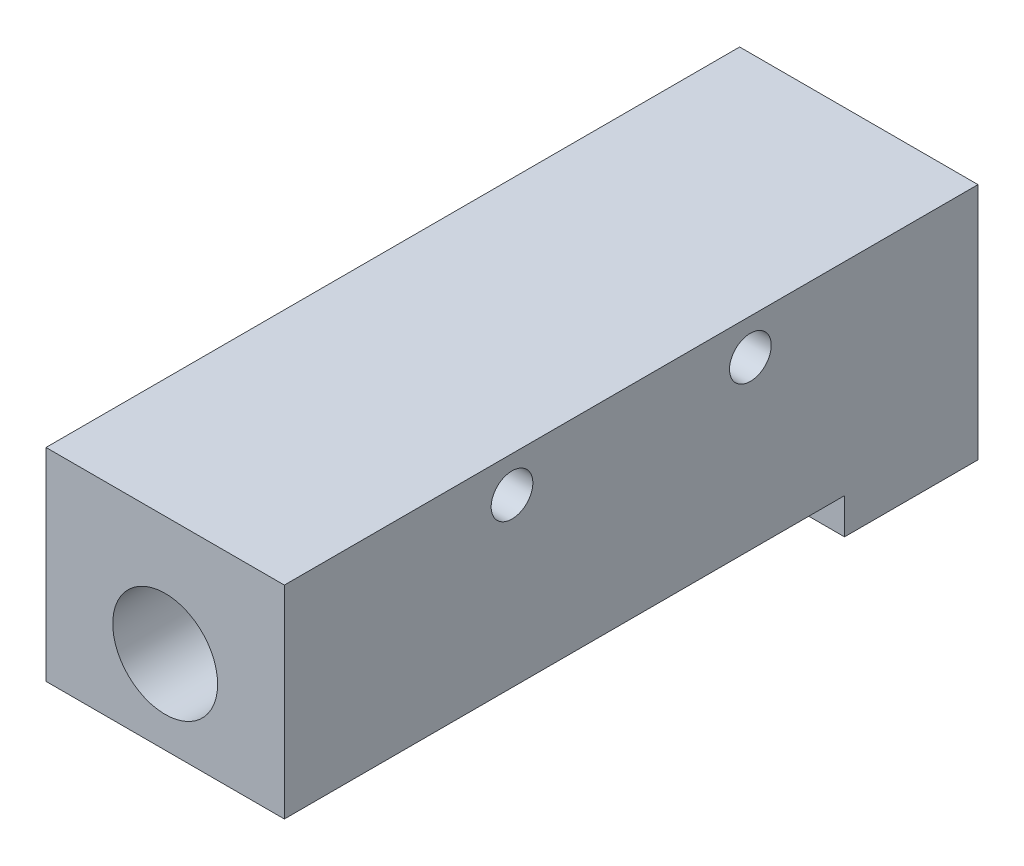
from build123d import *

# Parameters (mm, degrees)
SCHIZZO1_W                    = 20
SCHIZZO1_H                    = 20
ESTRUSIONE_ESTRUSIONE1_DEPTH  = 58.2
SCHIZZO2_R                    = 3
TAGLIO_ESTRUSIONE1_DEPTH      = 60.893572276
SCHIZZO3_R                    = 6
TAGLIO_ESTRUSIONE2_DEPTH      = 13
SCHIZZO4_R                    = 1.75
TAGLIO_ESTRUSIONE3_DEPTH      = 63.347734522
FORO_FILETTATO_G1_8_1_D       = 8.8
FORO_FILETTATO_G1_8_1_DEPTH   = 10
FORO_FILETTATO_G1_8_1_TIP     = 2.643786724
TAGLIO_ESTRUSIONE5_DEPTH      = 63.347734522
TAGLIO_ESTRUSIONE5_DEPTH_BACK = 63.347734522


with BuildPart() as part:
    # Schizzo1 → Estrusione-Estrusione1 (new body)
    with BuildSketch(Plane.XY):
        Rectangle(SCHIZZO1_W, SCHIZZO1_H)
    extrude(amount=-ESTRUSIONE_ESTRUSIONE1_DEPTH)

    # Schizzo2 → Taglio-Estrusione1 (cut, through all)
    with BuildSketch(Plane(origin=(0, 0, -58.2), x_dir=(-1, 0, 0), z_dir=(0, 0, -1))):
        Circle(SCHIZZO2_R)
    extrude(amount=-TAGLIO_ESTRUSIONE1_DEPTH, mode=Mode.SUBTRACT)

    # Schizzo3 → Taglio-Estrusione2 (cut)
    with BuildSketch(Plane(origin=(0, 0, -58.2), x_dir=(-1, 0, 0), z_dir=(0, 0, -1))):
        Circle(SCHIZZO3_R)
    extrude(amount=-TAGLIO_ESTRUSIONE2_DEPTH, mode=Mode.SUBTRACT)

    # Schizzo4 → Taglio-Estrusione3 (cut, through all)
    with BuildSketch(Plane(origin=(10, 0, 0), x_dir=(0, 0, -1), z_dir=(1, 0, 0))):
        with Locations((19.1, 7)):
            Circle(SCHIZZO4_R)
        with Locations((39.1, 7)):
            Circle(SCHIZZO4_R)
    extrude(amount=-TAGLIO_ESTRUSIONE3_DEPTH, mode=Mode.SUBTRACT)

    # Foro filettato G1/8-1
    with Locations(Plane.XY):
        with Locations((0, 0)):
            Hole(FORO_FILETTATO_G1_8_1_D / 2, depth=FORO_FILETTATO_G1_8_1_DEPTH)
            with Locations((0, 0, -(FORO_FILETTATO_G1_8_1_DEPTH + FORO_FILETTATO_G1_8_1_TIP / 2))):  # 118° drill point
                Cone(0, FORO_FILETTATO_G1_8_1_D / 2, FORO_FILETTATO_G1_8_1_TIP, mode=Mode.SUBTRACT)

    # Schizzo10 → Taglio-Estrusione5 (cut, two sides: drawn at the far end of the back side and taken through both)
    with BuildSketch(Plane(origin=(10, 0, 0), x_dir=(0, 0, -1), z_dir=(1, 0, 0)).offset(-TAGLIO_ESTRUSIONE5_DEPTH_BACK)):
        Polygon((-131.2640095, -7), (0, -7), (47, -7), (47, -10), (47, -141.2640095), (-110.942613081, -350.966397977), (-289.206622581, -216.702388477), align=None)
    extrude(amount=TAGLIO_ESTRUSIONE5_DEPTH + TAGLIO_ESTRUSIONE5_DEPTH_BACK, mode=Mode.SUBTRACT)


solid = part.part
